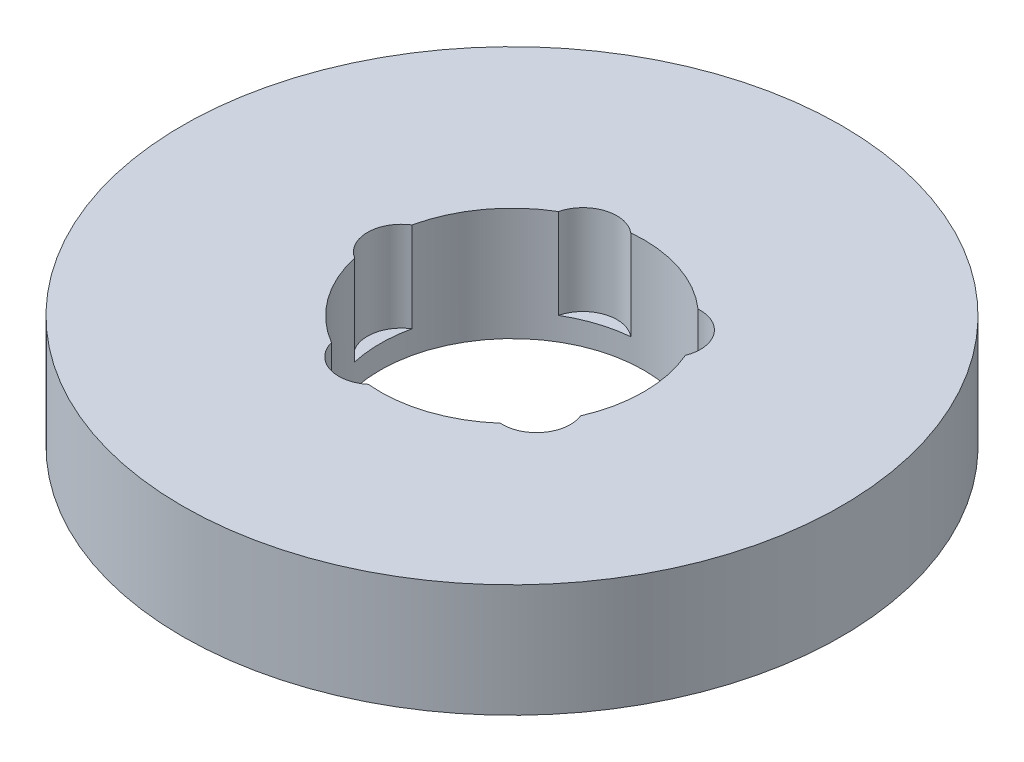
from build123d import *

# Parameters (mm, degrees)
SKETCH1_R           = 87.5
BOSS_EXTRUDE1_DEPTH = 30
SKETCH2_R           = 35
CUT_EXTRUDE1_DEPTH  = 128.328315782
SKETCH3_R           = 8.998380532
CUT_EXTRUDE2_DEPTH  = 23.884639592
CIRPATTERN1_COUNT   = 5


with BuildPart() as part:
    # Sketch1 → Boss-Extrude1 (new body)
    with BuildSketch(Plane(origin=(0, 0, 0), x_dir=(1, 0, 0), z_dir=(0, 1, 0))):
        Circle(SKETCH1_R)
    extrude(amount=BOSS_EXTRUDE1_DEPTH)

    # Sketch2 → Cut-Extrude1 (cut, through all)
    with BuildSketch(Plane(origin=(0, 0, 0), x_dir=(1, 0, 0), z_dir=(0, 1, 0))):
        Circle(SKETCH2_R)
    extrude(amount=CUT_EXTRUDE1_DEPTH, mode=Mode.SUBTRACT)

    # Sketch3 → Cut-Extrude2 (cut)
    with BuildSketch(Plane(origin=(0, 30, 0), x_dir=(1, 0, 0), z_dir=(0, 1, 0))):
        with Locations((-29.369105245, 0)):
            Circle(SKETCH3_R)
    cut_extrude2 = extrude(amount=-CUT_EXTRUDE2_DEPTH, mode=Mode.SUBTRACT)

    # CirPattern1: Cut-Extrude2 ×5 about axis
    cirpattern1_axis = Axis((0, 0, 0), (0, 1, 0))
    for i in range(1, CIRPATTERN1_COUNT):
        add(cut_extrude2.rotate(cirpattern1_axis, i * 360 / CIRPATTERN1_COUNT), mode=Mode.SUBTRACT)


solid = part.part
